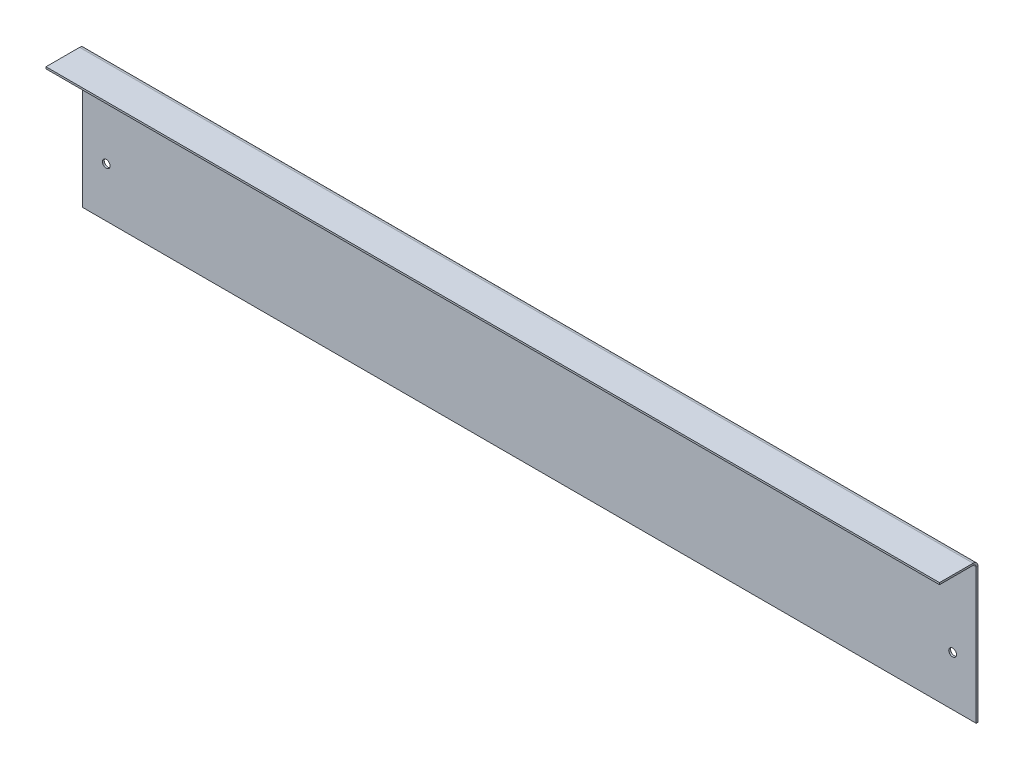
from build123d import *

# Parameters (mm, degrees)
SKETCH1_W                    = 580
SKETCH1_H                    = 91
BASE_FLANGE1_DEPTH           = 1.2
EDGE_FLANGE2_STRIP_W         = 8.8
EDGE_FLANGE2_STRIP_H         = 1.2
EDGE_FLANGE2_STRIP_CUT_DEPTH = 580
EDGE_FLANGE2_DEPTH           = 580
CUT_EXTRUDE1_START           = -1.2
CUT_EXTRUDE1_OUTLINE_R       = 2.5
CUT_EXTRUDE1_DEPTH           = 1.2
CUT_EXTRUDE2_DEPTH           = 811.392138245
CUT_EXTRUDE2_DEPTH_BACK      = 811.392138245
SKETCH18_R                   = 2.5


# Read off the part's stored shape, not the designer's step: Cut-Extrude1
# Sheet-metal steps are written as plain solids
with BuildPart() as part:
    # Sketch1 → Base-Flange1 (new body)
    with BuildSketch(Plane.XY):
        with Locations((290, 45.5)):
            Rectangle(SKETCH1_W, SKETCH1_H)
    extrude(amount=-BASE_FLANGE1_DEPTH)

    # Edge-Flange2 strip (across the edge) → Edge-Flange2 strip cut (cut)
    with BuildSketch(Plane(origin=(580, 91, 0), x_dir=(0, -1, 0), z_dir=(-1, 0, 0))):
        with Locations((-1.2, -0.6)):
            Rectangle(EDGE_FLANGE2_STRIP_W, EDGE_FLANGE2_STRIP_H)
    extrude(amount=EDGE_FLANGE2_STRIP_CUT_DEPTH, mode=Mode.SUBTRACT)

    # Edge-Flange2 section (across the edge) → Edge-Flange2 (add)
    with BuildSketch(Plane(origin=(580, 91, 0), x_dir=(0, -1, 0), z_dir=(-1, 0, 0))):
        with BuildLine():
            Line((0, 2), (0, 23.8))
            Line((0, 23.8), (1.2, 23.8))
            Line((1.2, 23.8), (1.2, 2))
            ThreePointArc((1.2, 2), (1.785786438, 0.585786438), (3.2, 0))
            Line((3.2, 0), (3.2, -1.2))
            ThreePointArc((3.2, -1.2), (0.9372583, -0.2627417), (0, 2))
        make_face()
    extrude(amount=EDGE_FLANGE2_DEPTH)

    # Cut-Extrude1 outline → Cut-Extrude1 (cut)
    with BuildSketch(Plane.XY.offset(CUT_EXTRUDE1_START)):
        with Locations((15.3, 32.2)):
            Circle(CUT_EXTRUDE1_OUTLINE_R)
    extrude(amount=CUT_EXTRUDE1_DEPTH, mode=Mode.SUBTRACT)

    # Sketch18 → Cut-Extrude2 (cut, two sides: drawn at the far end of the back side and taken through both)
    with BuildSketch(Plane.XY.offset(-534.818311308).offset(-CUT_EXTRUDE2_DEPTH_BACK)):
        with Locations(Location((15.3, 32.2, 0), (0, 0, 180))):
            Circle(SKETCH18_R)
        with Locations(Location((564.7, 32.2, 0), (0, 0, 180))):
            Circle(SKETCH18_R)
    extrude(amount=CUT_EXTRUDE2_DEPTH + CUT_EXTRUDE2_DEPTH_BACK, mode=Mode.SUBTRACT)


solid = part.part
